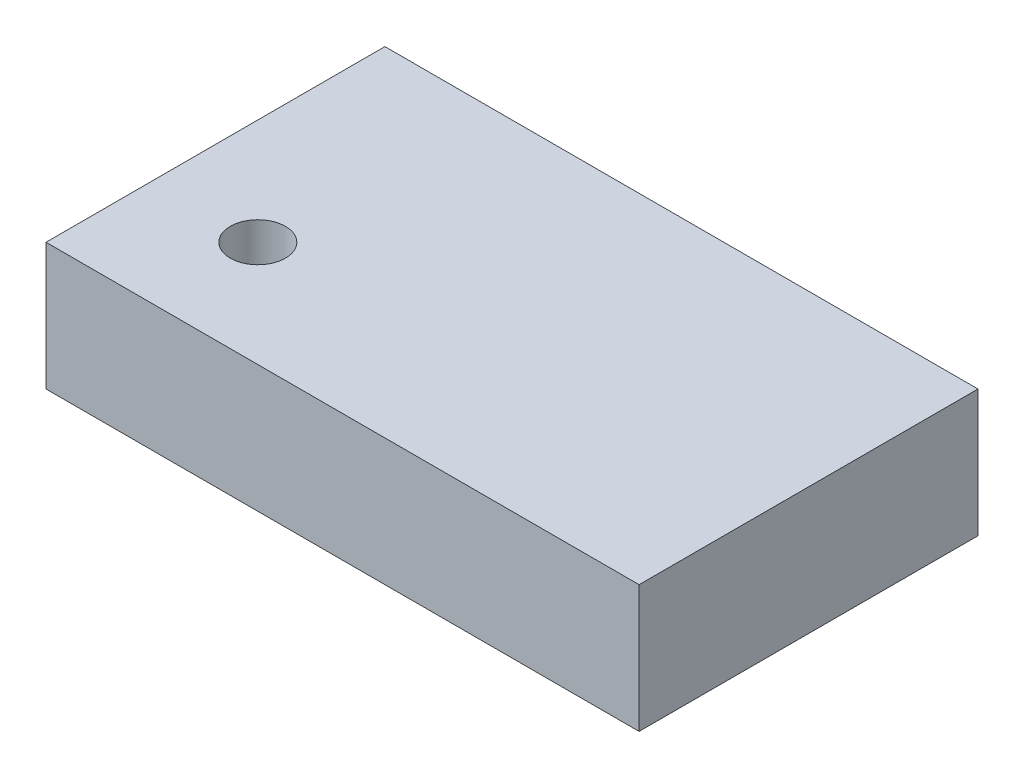
from build123d import *

# Parameters (mm, degrees)
SKETCH1_W           = 140
SKETCH1_H           = 30
BOSS_EXTRUDE1_DEPTH = 80
SKETCH2_R           = 4.17592015
CUT_EXTRUDE1_DEPTH  = 15
LPATTERN1_COUNT     = 4
LPATTERN1_PITCH     = 110
SKETCH3_R           = 6.515639915
CUT_EXTRUDE2_DEPTH  = 15


with BuildPart() as part:
    # Sketch1 → Boss-Extrude1 (new body)
    with BuildSketch(Plane.XY):
        with Locations((24.869684499, 8.141289438)):
            Rectangle(SKETCH1_W, SKETCH1_H)
    extrude(amount=BOSS_EXTRUDE1_DEPTH)

    # Sketch2 → Cut-Extrude1 (cut)
    with BuildSketch(Plane(origin=(0, 0, 0), x_dir=(-1, 0, 0), z_dir=(0, 0, -1))):
        with Locations((30.130315501, 7.814471991)):
            Circle(SKETCH2_R)
    cut_extrude1 = extrude(amount=-CUT_EXTRUDE1_DEPTH, mode=Mode.SUBTRACT)

    # LPattern1: Cut-Extrude1 ×4
    with Locations(*[(i * LPATTERN1_PITCH, 0, 0) for i in range(1, LPATTERN1_COUNT)]):
        add(cut_extrude1, mode=Mode.SUBTRACT)

    # Sketch3 → Cut-Extrude2 (cut)
    with BuildSketch(Plane(origin=(0, 23.141289438, 0), x_dir=(1, 0, 0), z_dir=(0, 1, 0))):
        with Locations((-20.130315501, -55)):
            Circle(SKETCH3_R)
    extrude(amount=-CUT_EXTRUDE2_DEPTH, mode=Mode.SUBTRACT)


solid = part.part
